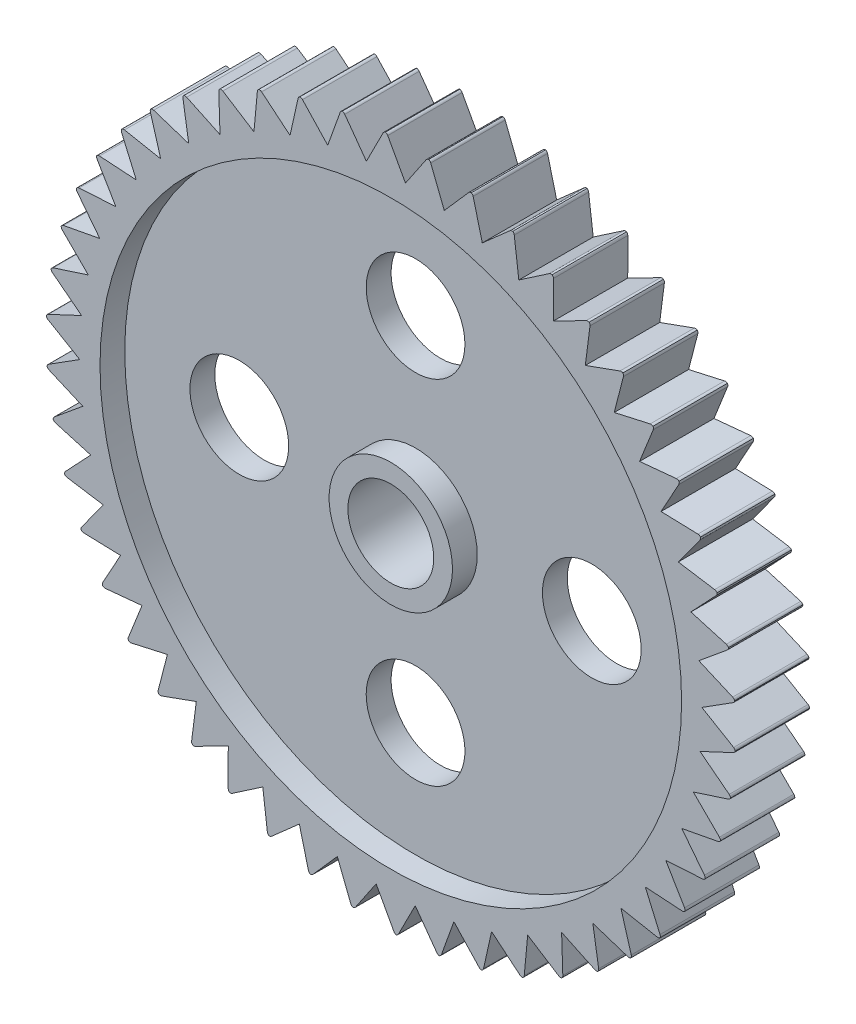
from build123d import *

# Parameters (mm, degrees)
SKETCH1_R         = 25.5
EXTRUDE1_DEPTH    = 2.75
SKETCH3_R         = 21.5
SKETCH3_R_2       = 4.56
EXTRUDE4_DEPTH    = 1.83
EXTRUDE5_REACH    = 38.479
SKETCH4_R         = 3.175
EXTRUDE6_REACH    = 38.249
SKETCH5_R         = 3.65
CIRPATTERN1_COUNT = 4
EXTRUDE17_REACH   = 38.479
CIRPATTERN2_COUNT = 50
FILLET2_R         = 0.25
CIRPATTERN3_START = -4
CIRPATTERN3_DEPTH = 8


with BuildPart() as part:
    # Sketch1 → Extrude1 (new, symmetric)
    with BuildSketch(Plane.XY):
        Circle(SKETCH1_R)
    extrude(amount=EXTRUDE1_DEPTH, both=True)

    # Sketch3 → Extrude4 (cut)
    with BuildSketch(Plane.XY.offset(2.75)):
        Circle(SKETCH3_R)
        Circle(SKETCH3_R_2, mode=Mode.SUBTRACT)
    extrude4 = extrude(amount=-EXTRUDE4_DEPTH, mode=Mode.SUBTRACT)

    # Mirror2: Extrude4 across plane
    add(extrude4.mirror(Plane.XY), mode=Mode.SUBTRACT)

    # Sketch4 → Extrude5 (cut, up to next)
    with BuildSketch(Plane.XY.offset(2.75), mode=Mode.PRIVATE) as extrude5_sk1:
        Circle(SKETCH4_R)
    extrude5_tool1 = extrude(extrude5_sk1.sketch, amount=-EXTRUDE5_REACH, mode=Mode.PRIVATE) & part.part
    add(extrude5_tool1.solids().sort_by_distance((0, 0, 2.75))[0], mode=Mode.SUBTRACT)

    # Sketch5 → Extrude6 (cut, up to next)
    with BuildSketch(Plane.XY.offset(0.92), mode=Mode.PRIVATE) as extrude6_sk1:
        with Locations((0, 13.03)):
            Circle(SKETCH5_R)
    extrude6_tool1 = extrude(extrude6_sk1.sketch, amount=-EXTRUDE6_REACH, mode=Mode.PRIVATE) & part.part
    extrude6 = extrude6_tool1.solids().sort_by_distance((0, 13.03, 0.92))[0]
    add(extrude6, mode=Mode.SUBTRACT)

    # CirPattern1: Extrude6 ×4 about axis
    cirpattern1_axis = Axis((0, 0, 0), (0, 0, 1))
    for i in range(1, CIRPATTERN1_COUNT):
        add(extrude6.rotate(cirpattern1_axis, i * 360 / CIRPATTERN1_COUNT), mode=Mode.SUBTRACT)

    # Sketch14 → Extrude17 (cut, up to next)
    with BuildSketch(Plane.XY.offset(2.75), mode=Mode.PRIVATE) as extrude17_sk1:
        with BuildLine():
            Line((-0.50186651, 25.495060894), (-1.804559202, 22.929098676))
            Line((-1.804559202, 22.929098676), (-3.492618511, 25.259683607))
            add(Edge.make_bspline(
                [(-3.492618511, 25.259683607), (-1.561624887, 25.678394055), (-0.50186651, 25.495060894)],
                knots=[0, 0, 0, 1, 1, 1], degree=2))
        make_face()
    extrude17_tool1 = extrude(extrude17_sk1.sketch, amount=-EXTRUDE17_REACH, mode=Mode.PRIVATE) & part.part
    extrude17 = extrude17_tool1.solids().sort_by_distance((-1.931473, 24.620278, 2.75))[0]
    add(extrude17, mode=Mode.SUBTRACT)

    # CirPattern2: Extrude17 ×50 about axis
    cirpattern2_axis = Axis((0, 0, 0), (0, 0, 1))
    for i in range(1, CIRPATTERN2_COUNT):
        add(extrude17.rotate(cirpattern2_axis, i * 360 / CIRPATTERN2_COUNT), mode=Mode.SUBTRACT)

    # Fillet2
    # the kernel refuses this fillet: 0.25 mm, written as the material it takes off along each edge
    with BuildSketch(Plane(origin=(-25.466716613, 1.302438085, 3.128331485), x_dir=(-0.04811234572385956, -0.9988419305320277, 0), z_dir=(0, 0, -1))) as fillet2_piece_1:
        with BuildLine():
            CenterArc((0.150590767, -0.249998899), FILLET2_R, 89.829985654, 62.296232796)
            Line((-0.070404148, -0.13311756), (0, 0))
            ThreePointArc((0, 0), (0.075666297, 0.000112263), (0.151332594, 0))
        make_face()
    extrude(amount=6.25666297, mode=Mode.SUBTRACT)
    with BuildSketch(Plane(origin=(-25.476264674, 1.099971928, 3.128331485), x_dir=(0.8614866635392321, -0.5077801970774775, 0), z_dir=(0, 0, -1))) as fillet2_piece_2:
        with BuildLine():
            CenterArc((0.15058894, -0.25), FILLET2_R, 90, 62.296232796)
            ThreePointArc((-0.070751825, -0.133774935), (-0.03547515, -0.066834982), (0, 0))
            Line((0, 0), (0.15058894, 0))
        make_face()
    extrude(amount=6.25666297, mode=Mode.SUBTRACT)

    # CirPattern3: read off the stored shape, not the designer's step
    # CirPattern3 outline → CirPattern3 (cut)
    with BuildSketch(Plane.XY.offset(CIRPATTERN3_START)):
        with BuildLine():
            Line((-25.137513679, 4.284320951), (-25.01839002, 4.192198301))
            ThreePointArc((-25.01839002, 4.192198301), (-25.088398954, 4.276846335), (-25.115364856, 4.383332863))
            ThreePointArc((-25.115364856, 4.383332863), (-25.053922132, 4.474389615), (-24.959378574, 4.530318642))
            Line((-24.959378574, 4.530318642), (-25.102665169, 4.483993913))
            ThreePointArc((-25.102665169, 4.483993913), (-25.120287817, 4.384192057), (-25.137513679, 4.284320951))
        make_face()
        with BuildLine():
            Line((-25.413239757, -2.10172431), (-25.274948614, -2.161327908))
            ThreePointArc((-25.274948614, -2.161327908), (-25.363809199, -2.096749762), (-25.41641004, -2.000314852))
            ThreePointArc((-25.41641004, -2.000314852), (-25.379542546, -1.89683863), (-25.30187823, -1.81915469))
            Line((-25.30187823, -1.81915469), (-25.429142722, -1.89965797))
            ThreePointArc((-25.429142722, -1.89965797), (-25.42139201, -2.000706941), (-25.413239757, -2.10172431))
        make_face()
        with BuildLine():
            Line((-24.949432867, -5.2702751), (-24.80476188, -5.31207623))
            ThreePointArc((-24.80476188, -5.31207623), (-24.90101556, -5.259144486), (-24.965288127, -5.170062627))
            ThreePointArc((-24.965288127, -5.170062627), (-24.941680353, -5.062781625), (-24.874364824, -4.975976326))
            Line((-24.874364824, -4.975976326), (-24.990536061, -5.071795283))
            ThreePointArc((-24.990536061, -5.071795283), (-24.970181671, -5.171076031), (-24.949432867, -5.2702751))
        make_face()
        with BuildLine():
            Line((-24.092158516, -8.355710504), (-23.943389232, -8.379049937))
            ThreePointArc((-23.943389232, -8.379049937), (-24.04551803, -8.33859936), (-24.120448706, -8.258275427))
            ThreePointArc((-24.120448706, -8.258275427), (-24.110472962, -8.148881529), (-24.054567824, -8.054323843))
            Line((-24.054567824, -8.054323843), (-24.157813717, -8.163947356))
            ThreePointArc((-24.157813717, -8.163947356), (-24.12517665, -8.259894164), (-24.092158516, -8.355710504))
        make_face()
        with BuildLine():
            Line((-22.854936434, -11.309371361), (-22.704415034, -11.31388102))
            ThreePointArc((-22.704415034, -11.31388102), (-22.810808317, -11.286549541), (-22.895215401, -11.21625029))
            ThreePointArc((-22.895215401, -11.21625029), (-22.899029009, -11.106468703), (-22.855415921, -11.005649861))
            Line((-22.855415921, -11.005649861), (-22.944108219, -11.127349101))
            ThreePointArc((-22.944108219, -11.127349101), (-22.899703182, -11.218448831), (-22.854936434, -11.309371361))
        make_face()
        with BuildLine():
            Line((-21.257278352, -14.084676676), (-21.107378648, -14.070285441))
            ThreePointArc((-21.107378648, -14.070285441), (-21.216358531, -14.056504093), (-21.308910872, -13.997338186))
            ThreePointArc((-21.308910872, -13.997338186), (-21.32645369, -13.888900231), (-21.295820455, -13.783410206))
            Line((-21.295820455, -13.783410206), (-21.368560429, -13.915265905))
            ThreePointArc((-21.368560429, -13.915265905), (-21.313087715, -14.000081859), (-21.257278352, -14.084676676))
        make_face()
        with BuildLine():
            Line((-19.324380291, -16.637858226), (-19.177466291, -16.604793056))
            ThreePointArc((-19.177466291, -16.604793056), (-19.287314096, -16.604779179), (-19.386552089, -16.557679697))
            ThreePointArc((-19.386552089, -16.557679697), (-19.417547456, -16.452295506), (-19.40037718, -16.343797939))
            Line((-19.40037718, -16.343797939), (-19.456017676, -16.483730652))
            ThreePointArc((-19.456017676, -16.483730652), (-19.390352123, -16.560925232), (-19.324380291, -16.637858226))
        make_face()
        with BuildLine():
            Line((-17.08672521, -18.928650813), (-16.945113835, -18.877433165))
            ThreePointArc((-16.945113835, -18.877433165), (-17.054097196, -18.891186978), (-17.158455798, -18.856896708))
            ThreePointArc((-17.158455798, -18.856896708), (-17.202414899, -18.756228253), (-17.198978366, -18.646434215))
            Line((-17.198978366, -18.646434215), (-17.236641901, -18.79223712))
            ThreePointArc((-17.236641901, -18.79223712), (-17.161819094, -18.860592922), (-17.08672521, -18.928650813))
        make_face()
        with BuildLine():
            Line((-14.579602264, -20.920927269), (-14.445526811, -20.852364876))
            ThreePointArc((-14.445526811, -20.852364876), (-14.551926996, -20.879669474), (-14.65976041, -20.858729193))
            ThreePointArc((-14.65976041, -20.858729193), (-14.715989983, -20.764364075), (-14.72634139, -20.655005084))
            Line((-14.72634139, -20.655005084), (-14.745433988, -20.804378782))
            ThreePointArc((-14.745433988, -20.804378782), (-14.662633927, -20.862817794), (-14.579602264, -20.920927269))
        make_face()
        with BuildLine():
            Line((-11.842550282, -22.583268205), (-11.7181252, -22.498442337))
            ThreePointArc((-11.7181252, -22.498442337), (-11.820264215, -22.538867108), (-11.929871843, -22.531607059))
            ThreePointArc((-11.929871843, -22.531607059), (-11.997485115, -22.445033472), (-12.021461213, -22.337834185))
            Line((-12.021461213, -22.337834185), (-12.021681771, -22.488422964))
            ThreePointArc((-12.021681771, -22.488422964), (-11.932210264, -22.536023567), (-11.842550282, -22.583268205))
        make_face()
        with BuildLine():
            Line((-8.918734207, -23.88945751), (-8.805921755, -23.789705921))
            ThreePointArc((-8.805921755, -23.789705921), (-8.902188805, -23.842613345), (-9.01184207, -23.849148021))
            ThreePointArc((-9.01184207, -23.849148021), (-9.089772738, -23.771731283), (-9.126995412, -23.668382296))
            Line((-9.126995412, -23.668382296), (-9.108340452, -23.817811281))
            ThreePointArc((-9.108340452, -23.817811281), (-9.013608516, -23.853822786), (-8.918734207, -23.88945751))
        make_face()
        with BuildLine():
            Line((-5.854264366, -24.8188958), (-5.754843663, -24.705791633))
            ThreePointArc((-5.754843663, -24.705791633), (-5.84372056, -24.770347326), (-5.951690164, -24.790573673))
            ThreePointArc((-5.951690164, -24.790573673), (-6.038709216, -24.723534691), (-6.088591441, -24.62566588))
            Line((-6.088591441, -24.62566588), (-6.051355163, -24.771578486))
            ThreePointArc((-6.051355163, -24.771578486), (-5.952856778, -24.79543297), (-5.854264366, -24.8188958))
        make_face()
        with BuildLine():
            Line((-2.697469279, -25.356925277), (-2.613008249, -25.232252251))
            ThreePointArc((-2.613008249, -25.232252251), (-2.693093352, -25.307438132), (-2.797676549, -25.341037168))
            ThreePointArc((-2.797676549, -25.341037168), (-2.892411642, -25.285433188), (-2.954166745, -25.194588003))
            Line((-2.954166745, -25.194588003), (-2.898936388, -25.334683101))
            ThreePointArc((-2.898936388, -25.334683101), (-2.798224933, -25.346004364), (-2.697469279, -25.356925277))
        make_face()
        with BuildLine():
            Line((0.50186651, -25.495060894), (0.570035867, -25.360785179))
            ThreePointArc((0.570035867, -25.360785179), (0.500005548, -25.445415522), (0.400458096, -25.491857369))
            ThreePointArc((0.400458096, -25.491857369), (0.299500991, -25.448565299), (0.226846925, -25.366176422))
            Line((0.226846925, -25.366176422), (0.299200346, -25.498244629))
            ThreePointArc((0.299200346, -25.498244629), (0.400536591, -25.496854128), (0.50186651, -25.495060894))
        make_face()
        with BuildLine():
            Line((3.693287565, -25.231124172), (3.744090176, -25.089363374))
            ThreePointArc((3.744090176, -25.089363374), (3.685219062, -25.182103508), (3.592277278, -25.240655752))
            ThreePointArc((3.592277278, -25.240655752), (3.486690314, -25.210358333), (3.404283083, -25.137725085))
            Line((3.404283083, -25.137725085), (3.492618511, -25.259683607))
            ThreePointArc((3.492618511, -25.259683607), (3.592981414, -25.245603272), (3.693287565, -25.231124172))
        make_face()
        with BuildLine():
            Line((6.826463268, -24.569277548), (6.859097946, -24.422267322))
            ThreePointArc((6.859097946, -24.422267322), (6.81231447, -24.521654679), (6.727444101, -24.591393915))
            ThreePointArc((6.727444101, -24.591393915), (6.618892449, -24.574568956), (6.528031664, -24.512836808))
            Line((6.528031664, -24.512836808), (6.630955997, -24.622762286))
            ThreePointArc((6.630955997, -24.622762286), (6.728762774, -24.596214171), (6.826463268, -24.569277548))
        make_face()
        with BuildLine():
            Line((9.851981568, -23.519958741), (9.865933645, -23.370017524))
            ThreePointArc((9.865933645, -23.370017524), (9.831975609, -23.474484707), (9.756515113, -23.554311106))
            ThreePointArc((9.756515113, -23.554311106), (9.646710696, -23.551223947), (9.548829285, -23.501366451))
            Line((9.548829285, -23.501366451), (9.664719345, -23.597525294))
            ThreePointArc((9.664719345, -23.597525294), (9.758427526, -23.558928079), (9.851981568, -23.519958741))
        make_face()
        with BuildLine():
            Line((12.722128233, -22.099716135), (12.717177676, -21.94920859))
            ThreePointArc((12.717177676, -21.94920859), (12.696580619, -22.057108088), (12.631720052, -22.14576274))
            ThreePointArc((12.631720052, -22.14576274), (12.522394553, -22.156462066), (12.419036165, -22.119265506))
            Line((12.419036165, -22.119265506), (12.546064295, -22.200141232))
            ThreePointArc((12.546064295, -22.200141232), (12.634196045, -22.150103618), (12.722128233, -22.099716135))
        make_face()
        with BuildLine():
            Line((15.391639336, -20.330947803), (15.367864218, -20.182247525))
            ThreePointArc((15.367864218, -20.182247525), (15.360952968, -20.291877699), (15.307715221, -20.387962467))
            ThreePointArc((15.307715221, -20.387962467), (15.200592766, -20.412279544), (15.093387425, -20.38833053))
            Line((15.093387425, -20.38833053), (15.229550317, -20.452647681))
            ThreePointArc((15.229550317, -20.452647681), (15.310715746, -20.391958791), (15.391639336, -20.330947803))
        make_face()
        with BuildLine():
            Line((17.818415092, -18.241548279), (17.776190362, -18.097000359))
            ThreePointArc((17.776190362, -18.097000359), (17.783073913, -18.206632276), (17.742298576, -18.308631846))
            ThreePointArc((17.742298576, -18.308631846), (17.639068552, -18.34618318), (17.529706949, -18.335859403))
            Line((17.529706949, -18.335859403), (17.672857232, -18.382603658))
            ThreePointArc((17.672857232, -18.382603658), (17.745776313, -18.312220593), (17.818415092, -18.241548279))
        make_face()
        with BuildLine():
            Line((19.964183798, -15.864468642), (19.904175364, -15.726352688))
            ThreePointArc((19.904175364, -15.726352688), (19.924745159, -15.834257386), (19.897075283, -15.940563164))
            ThreePointArc((19.897075283, -15.940563164), (19.799365689, -15.990756547), (19.689572523, -15.99422082))
            Line((19.689572523, -15.99422082), (19.837452632, -16.022654994))
            ThreePointArc((19.837452632, -16.022654994), (19.900975387, -15.943687737), (19.964183798, -15.864468642))
        make_face()
        with BuildLine():
            Line((21.795105399, -13.237196857), (21.718259631, -13.10769104))
            ThreePointArc((21.718259631, -13.10769104), (21.752191272, -13.212166799), (21.738063228, -13.321102279))
            ThreePointArc((21.738063228, -13.321102279), (21.647415002, -13.383146131), (21.538921777, -13.400343819))
            Line((21.538921777, -13.400343819), (21.689199554, -13.41001949))
            ThreePointArc((21.689199554, -13.41001949), (21.742324191, -13.3237134), (21.795105399, -13.237196857))
        make_face()
        with BuildLine():
            Line((23.282305169, -10.401166571), (23.189833969, -10.282313274))
            ThreePointArc((23.189833969, -10.282313274), (23.236592334, -10.381712448), (23.23622893, -10.491559653))
            ThreePointArc((23.23622893, -10.491559653), (23.154071649, -10.564475506), (23.048589367, -10.595135392))
            Line((23.048589367, -10.595135392), (23.198894842, -10.585899967))
            ThreePointArc((23.198894842, -10.585899967), (23.240783554, -10.493616144), (23.282305169, -10.401166571))
        make_face()
        with BuildLine():
            Line((24.402329077, -7.401103674), (24.295690773, -7.294777285))
            ThreePointArc((24.295690773, -7.294777285), (24.354538454, -7.38753229), (24.367945421, -7.496558864))
            ThreePointArc((24.367945421, -7.496558864), (24.295574754, -7.579196791), (24.194766934, -7.622835351))
            Line((24.194766934, -7.622835351), (24.3427297, -7.594834478))
            ThreePointArc((24.3427297, -7.594834478), (24.372721877, -7.498028293), (24.402329077, -7.401103674))
        make_face()
        with BuildLine():
            Line((25.137513679, -4.284320951), (25.01839002, -4.192198301))
            ThreePointArc((25.01839002, -4.192198301), (25.088398954, -4.276846335), (25.115364856, -4.383332863))
            ThreePointArc((25.115364856, -4.383332863), (25.053922132, -4.474389615), (24.959378574, -4.530318642))
            Line((24.959378574, -4.530318642), (25.102665169, -4.483993913))
            ThreePointArc((25.102665169, -4.483993913), (25.120287817, -4.384192057), (25.137513679, -4.284320951))
        make_face()
        with BuildLine():
            Line((25.476264674, -1.099971928), (25.346534311, -1.023505846))
            ThreePointArc((25.346534311, -1.023505846), (25.426600415, -1.098711959), (25.466699984, -1.200979084))
            ThreePointArc((25.466699984, -1.200979084), (25.417154192, -1.299018642), (25.330365903, -1.366356102))
            Line((25.330365903, -1.366356102), (25.466716613, -1.302438085))
            ThreePointArc((25.466716613, -1.302438085), (25.471691812, -1.201214493), (25.476264674, -1.099971928))
        make_face()
        with BuildLine():
            Line((25.413239757, 2.10172431), (25.274948614, 2.161327908))
            ThreePointArc((25.274948614, 2.161327908), (25.363809199, 2.096749762), (25.41641004, 2.000314852))
            ThreePointArc((25.41641004, 2.000314852), (25.379542546, 1.89683863), (25.30187823, 1.81915469))
            Line((25.30187823, 1.81915469), (25.429142722, 1.89965797))
            ThreePointArc((25.429142722, 1.89965797), (25.42139201, 2.000706941), (25.413239757, 2.10172431))
        make_face()
        with BuildLine():
            Line((24.949432867, 5.2702751), (24.80476188, 5.31207623))
            ThreePointArc((24.80476188, 5.31207623), (24.90101556, 5.259144486), (24.965288127, 5.170062627))
            ThreePointArc((24.965288127, 5.170062627), (24.941680353, 5.062781625), (24.874364824, 4.975976326))
            Line((24.874364824, 4.975976326), (24.990536061, 5.071795283))
            ThreePointArc((24.990536061, 5.071795283), (24.970181671, 5.171076031), (24.949432867, 5.2702751))
        make_face()
        with BuildLine():
            Line((24.092158516, 8.355710504), (23.943389232, 8.379049937))
            ThreePointArc((23.943389232, 8.379049937), (24.04551803, 8.33859936), (24.120448706, 8.258275427))
            ThreePointArc((24.120448706, 8.258275427), (24.110472962, 8.148881529), (24.054567824, 8.054323843))
            Line((24.054567824, 8.054323843), (24.157813717, 8.163947356))
            ThreePointArc((24.157813717, 8.163947356), (24.12517665, 8.259894164), (24.092158516, 8.355710504))
        make_face()
        with BuildLine():
            Line((22.854936434, 11.309371361), (22.704415034, 11.31388102))
            ThreePointArc((22.704415034, 11.31388102), (22.810808317, 11.286549541), (22.895215401, 11.21625029))
            ThreePointArc((22.895215401, 11.21625029), (22.899029009, 11.106468703), (22.855415921, 11.005649861))
            Line((22.855415921, 11.005649861), (22.944108219, 11.127349101))
            ThreePointArc((22.944108219, 11.127349101), (22.899703182, 11.218448831), (22.854936434, 11.309371361))
        make_face()
        with BuildLine():
            Line((21.257278352, 14.084676676), (21.107378648, 14.070285441))
            ThreePointArc((21.107378648, 14.070285441), (21.216358531, 14.056504093), (21.308910872, 13.997338186))
            ThreePointArc((21.308910872, 13.997338186), (21.32645369, 13.888900231), (21.295820455, 13.783410206))
            Line((21.295820455, 13.783410206), (21.368560429, 13.915265905))
            ThreePointArc((21.368560429, 13.915265905), (21.313087715, 14.000081859), (21.257278352, 14.084676676))
        make_face()
        with BuildLine():
            Line((19.324380291, 16.637858226), (19.177466291, 16.604793056))
            ThreePointArc((19.177466291, 16.604793056), (19.287314096, 16.604779179), (19.386552089, 16.557679697))
            ThreePointArc((19.386552089, 16.557679697), (19.417547456, 16.452295506), (19.40037718, 16.343797939))
            Line((19.40037718, 16.343797939), (19.456017676, 16.483730652))
            ThreePointArc((19.456017676, 16.483730652), (19.390352123, 16.560925232), (19.324380291, 16.637858226))
        make_face()
        with BuildLine():
            Line((17.08672521, 18.928650813), (16.945113835, 18.877433165))
            ThreePointArc((16.945113835, 18.877433165), (17.054097196, 18.891186978), (17.158455798, 18.856896708))
            ThreePointArc((17.158455798, 18.856896708), (17.202414899, 18.756228253), (17.198978366, 18.646434215))
            Line((17.198978366, 18.646434215), (17.236641901, 18.79223712))
            ThreePointArc((17.236641901, 18.79223712), (17.161819094, 18.860592922), (17.08672521, 18.928650813))
        make_face()
        with BuildLine():
            Line((14.579602264, 20.920927269), (14.445526811, 20.852364876))
            ThreePointArc((14.445526811, 20.852364876), (14.551926996, 20.879669474), (14.65976041, 20.858729193))
            ThreePointArc((14.65976041, 20.858729193), (14.715989983, 20.764364075), (14.72634139, 20.655005084))
            Line((14.72634139, 20.655005084), (14.745433988, 20.804378782))
            ThreePointArc((14.745433988, 20.804378782), (14.662633927, 20.862817794), (14.579602264, 20.920927269))
        make_face()
        with BuildLine():
            Line((11.842550282, 22.583268205), (11.7181252, 22.498442337))
            ThreePointArc((11.7181252, 22.498442337), (11.820264215, 22.538867108), (11.929871843, 22.531607059))
            ThreePointArc((11.929871843, 22.531607059), (11.997485115, 22.445033472), (12.021461213, 22.337834185))
            Line((12.021461213, 22.337834185), (12.021681771, 22.488422964))
            ThreePointArc((12.021681771, 22.488422964), (11.932210264, 22.536023567), (11.842550282, 22.583268205))
        make_face()
        with BuildLine():
            Line((8.918734207, 23.88945751), (8.805921755, 23.789705921))
            ThreePointArc((8.805921755, 23.789705921), (8.902188805, 23.842613345), (9.01184207, 23.849148021))
            ThreePointArc((9.01184207, 23.849148021), (9.089772738, 23.771731283), (9.126995412, 23.668382296))
            Line((9.126995412, 23.668382296), (9.108340452, 23.817811281))
            ThreePointArc((9.108340452, 23.817811281), (9.013608516, 23.853822786), (8.918734207, 23.88945751))
        make_face()
        with BuildLine():
            Line((5.854264366, 24.8188958), (5.754843663, 24.705791633))
            ThreePointArc((5.754843663, 24.705791633), (5.84372056, 24.770347326), (5.951690164, 24.790573673))
            ThreePointArc((5.951690164, 24.790573673), (6.038709216, 24.723534691), (6.088591441, 24.62566588))
            Line((6.088591441, 24.62566588), (6.051355163, 24.771578486))
            ThreePointArc((6.051355163, 24.771578486), (5.952856778, 24.79543297), (5.854264366, 24.8188958))
        make_face()
        with BuildLine():
            Line((2.697469279, 25.356925277), (2.613008249, 25.232252251))
            ThreePointArc((2.613008249, 25.232252251), (2.693093352, 25.307438132), (2.797676549, 25.341037168))
            ThreePointArc((2.797676549, 25.341037168), (2.892411642, 25.285433188), (2.954166745, 25.194588003))
            Line((2.954166745, 25.194588003), (2.898936388, 25.334683101))
            ThreePointArc((2.898936388, 25.334683101), (2.798224933, 25.346004364), (2.697469279, 25.356925277))
        make_face()
        with BuildLine():
            Line((-0.50186651, 25.495060894), (-0.570035867, 25.360785179))
            ThreePointArc((-0.570035867, 25.360785179), (-0.500005548, 25.445415522), (-0.400458096, 25.491857369))
            ThreePointArc((-0.400458096, 25.491857369), (-0.299500991, 25.448565299), (-0.226846925, 25.366176422))
            Line((-0.226846925, 25.366176422), (-0.299200346, 25.498244629))
            ThreePointArc((-0.299200346, 25.498244629), (-0.400536591, 25.496854128), (-0.50186651, 25.495060894))
        make_face()
        with BuildLine():
            Line((-3.693287565, 25.231124172), (-3.744090176, 25.089363374))
            ThreePointArc((-3.744090176, 25.089363374), (-3.685219062, 25.182103508), (-3.592277278, 25.240655752))
            ThreePointArc((-3.592277278, 25.240655752), (-3.486690314, 25.210358333), (-3.404283083, 25.137725085))
            Line((-3.404283083, 25.137725085), (-3.492618511, 25.259683607))
            ThreePointArc((-3.492618511, 25.259683607), (-3.592981414, 25.245603272), (-3.693287565, 25.231124172))
        make_face()
        with BuildLine():
            Line((-6.826463268, 24.569277548), (-6.859097946, 24.422267322))
            ThreePointArc((-6.859097946, 24.422267322), (-6.81231447, 24.521654679), (-6.727444101, 24.591393915))
            ThreePointArc((-6.727444101, 24.591393915), (-6.618892449, 24.574568956), (-6.528031664, 24.512836808))
            Line((-6.528031664, 24.512836808), (-6.630955997, 24.622762286))
            ThreePointArc((-6.630955997, 24.622762286), (-6.728762774, 24.596214171), (-6.826463268, 24.569277548))
        make_face()
        with BuildLine():
            Line((-9.851981568, 23.519958741), (-9.865933645, 23.370017524))
            ThreePointArc((-9.865933645, 23.370017524), (-9.831975609, 23.474484707), (-9.756515113, 23.554311106))
            ThreePointArc((-9.756515113, 23.554311106), (-9.646710696, 23.551223947), (-9.548829285, 23.501366451))
            Line((-9.548829285, 23.501366451), (-9.664719345, 23.597525294))
            ThreePointArc((-9.664719345, 23.597525294), (-9.758427526, 23.558928079), (-9.851981568, 23.519958741))
        make_face()
        with BuildLine():
            Line((-12.722128233, 22.099716135), (-12.717177676, 21.94920859))
            ThreePointArc((-12.717177676, 21.94920859), (-12.696580619, 22.057108088), (-12.631720052, 22.14576274))
            ThreePointArc((-12.631720052, 22.14576274), (-12.522394553, 22.156462066), (-12.419036165, 22.119265506))
            Line((-12.419036165, 22.119265506), (-12.546064295, 22.200141232))
            ThreePointArc((-12.546064295, 22.200141232), (-12.634196045, 22.150103618), (-12.722128233, 22.099716135))
        make_face()
        with BuildLine():
            Line((-15.391639336, 20.330947803), (-15.367864218, 20.182247525))
            ThreePointArc((-15.367864218, 20.182247525), (-15.360952968, 20.291877699), (-15.307715221, 20.387962467))
            ThreePointArc((-15.307715221, 20.387962467), (-15.200592766, 20.412279544), (-15.093387425, 20.38833053))
            Line((-15.093387425, 20.38833053), (-15.229550317, 20.452647681))
            ThreePointArc((-15.229550317, 20.452647681), (-15.310715746, 20.391958791), (-15.391639336, 20.330947803))
        make_face()
        with BuildLine():
            Line((-17.818415092, 18.241548279), (-17.776190362, 18.097000359))
            ThreePointArc((-17.776190362, 18.097000359), (-17.783073913, 18.206632276), (-17.742298576, 18.308631846))
            ThreePointArc((-17.742298576, 18.308631846), (-17.639068552, 18.34618318), (-17.529706949, 18.335859403))
            Line((-17.529706949, 18.335859403), (-17.672857232, 18.382603658))
            ThreePointArc((-17.672857232, 18.382603658), (-17.745776313, 18.312220593), (-17.818415092, 18.241548279))
        make_face()
        with BuildLine():
            Line((-19.964183798, 15.864468642), (-19.904175364, 15.726352688))
            ThreePointArc((-19.904175364, 15.726352688), (-19.924745159, 15.834257386), (-19.897075283, 15.940563164))
            ThreePointArc((-19.897075283, 15.940563164), (-19.799365689, 15.990756547), (-19.689572523, 15.99422082))
            Line((-19.689572523, 15.99422082), (-19.837452632, 16.022654994))
            ThreePointArc((-19.837452632, 16.022654994), (-19.900975387, 15.943687737), (-19.964183798, 15.864468642))
        make_face()
        with BuildLine():
            Line((-21.795105399, 13.237196857), (-21.718259631, 13.10769104))
            ThreePointArc((-21.718259631, 13.10769104), (-21.752191272, 13.212166799), (-21.738063228, 13.321102279))
            ThreePointArc((-21.738063228, 13.321102279), (-21.647415002, 13.383146131), (-21.538921777, 13.400343819))
            Line((-21.538921777, 13.400343819), (-21.689199554, 13.41001949))
            ThreePointArc((-21.689199554, 13.41001949), (-21.742324191, 13.3237134), (-21.795105399, 13.237196857))
        make_face()
        with BuildLine():
            Line((-23.282305169, 10.401166571), (-23.189833969, 10.282313274))
            ThreePointArc((-23.189833969, 10.282313274), (-23.236592334, 10.381712448), (-23.23622893, 10.491559653))
            ThreePointArc((-23.23622893, 10.491559653), (-23.154071649, 10.564475506), (-23.048589367, 10.595135392))
            Line((-23.048589367, 10.595135392), (-23.198894842, 10.585899967))
            ThreePointArc((-23.198894842, 10.585899967), (-23.240783554, 10.493616144), (-23.282305169, 10.401166571))
        make_face()
        with BuildLine():
            Line((-24.402329077, 7.401103674), (-24.295690773, 7.294777285))
            ThreePointArc((-24.295690773, 7.294777285), (-24.354538454, 7.38753229), (-24.367945421, 7.496558864))
            ThreePointArc((-24.367945421, 7.496558864), (-24.295574754, 7.579196791), (-24.194766934, 7.622835351))
            Line((-24.194766934, 7.622835351), (-24.3427297, 7.594834478))
            ThreePointArc((-24.3427297, 7.594834478), (-24.372721877, 7.498028293), (-24.402329077, 7.401103674))
        make_face()
    extrude(amount=CIRPATTERN3_DEPTH, mode=Mode.SUBTRACT)


solid = part.part
